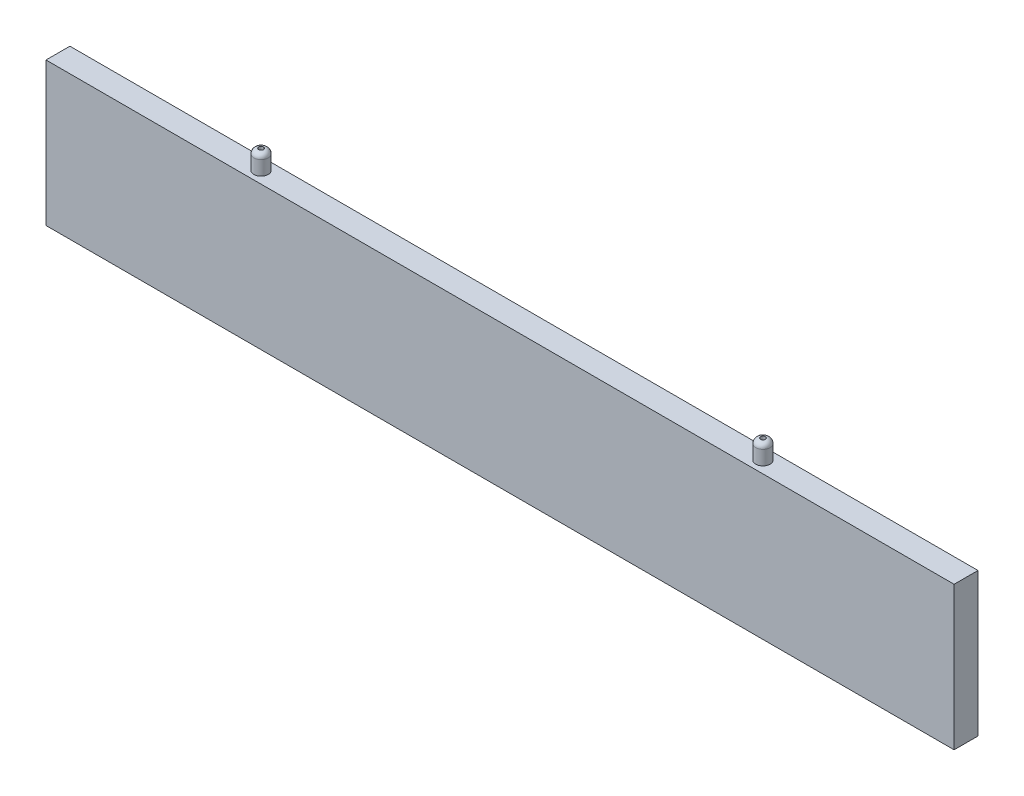
from build123d import *

# Parameters (mm, degrees)
ESQUISSE1_W        = 190
ESQUISSE1_H        = 30
BOSS_EXTRU_1_DEPTH = 5
ESQUISSE2_R        = 1.5
ESQUISSE2_R_2      = 0.5
BOSS_EXTRU_2_DEPTH = 4
CONG_1_R           = 1


with BuildPart() as part:
    # Esquisse1 → Boss.-Extru.1 (new body)
    with BuildSketch(Plane.XY):
        Rectangle(ESQUISSE1_W, ESQUISSE1_H)
    extrude(amount=BOSS_EXTRU_1_DEPTH)

    # Esquisse2 → Boss.-Extru.2 (add)
    # profile 1 of 2: a face of its own
    with BuildSketch(Plane(origin=(0, 15, 0), x_dir=(1, 0, 0), z_dir=(0, 1, 0))):
        with Locations(Location((-52.5, -2.5, 0), (0, 0, 90))):
            Circle(ESQUISSE2_R)
        with Locations(Location((-52.5, -2.5, 0), (0, 0, 270))):
            Circle(ESQUISSE2_R_2, mode=Mode.SUBTRACT)
    # profile 2 of 2: a face of its own
    with BuildSketch(Plane(origin=(0, 15, 0), x_dir=(1, 0, 0), z_dir=(0, 1, 0))):
        with Locations(Location((52.5, -2.5, 0), (0, 0, 90))):
            Circle(ESQUISSE2_R)
        with Locations(Location((52.5, -2.5, 0), (0, 0, 90))):
            Circle(ESQUISSE2_R_2, mode=Mode.SUBTRACT)
    extrude(amount=BOSS_EXTRU_2_DEPTH)

    # Congé1
    cong_1_edges = [part.edges().sort_by_distance(p)[0] for p in [
        (-52.5, 19, 4),
        (52.5, 19, 4),
    ]]
    fillet(cong_1_edges, radius=CONG_1_R - 0.0001)  # a hair under: the kernel refuses the full size


solid = part.part
